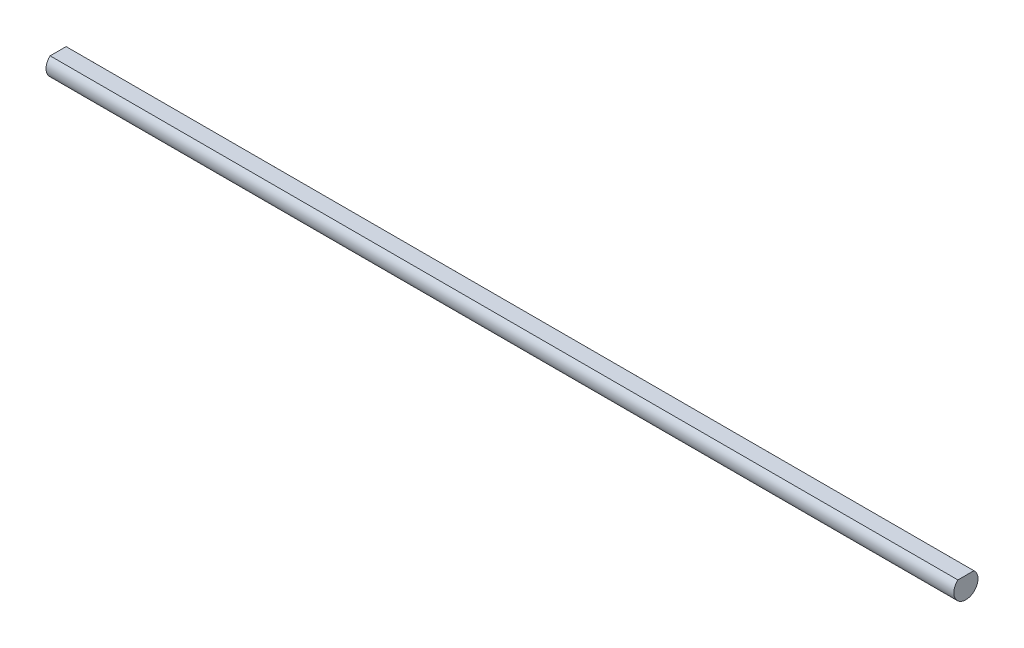
from build123d import *

# Parameters (mm, degrees)
BOSS_EXTRUDE1_DEPTH = 75


with BuildPart() as part:
    # Sketch1 → Boss-Extrude1 (new, symmetric)
    with BuildSketch(Plane(origin=(0, 0, 0), x_dir=(0, 0, -1), z_dir=(1, 0, 0))):
        with BuildLine():
            Line((-1.322875656, 1.5), (1.322875656, 1.5))
            ThreePointArc((1.322875656, 1.5), (0, -2), (-1.322875656, 1.5))
        make_face()
    extrude(amount=BOSS_EXTRUDE1_DEPTH, both=True)


solid = part.part
